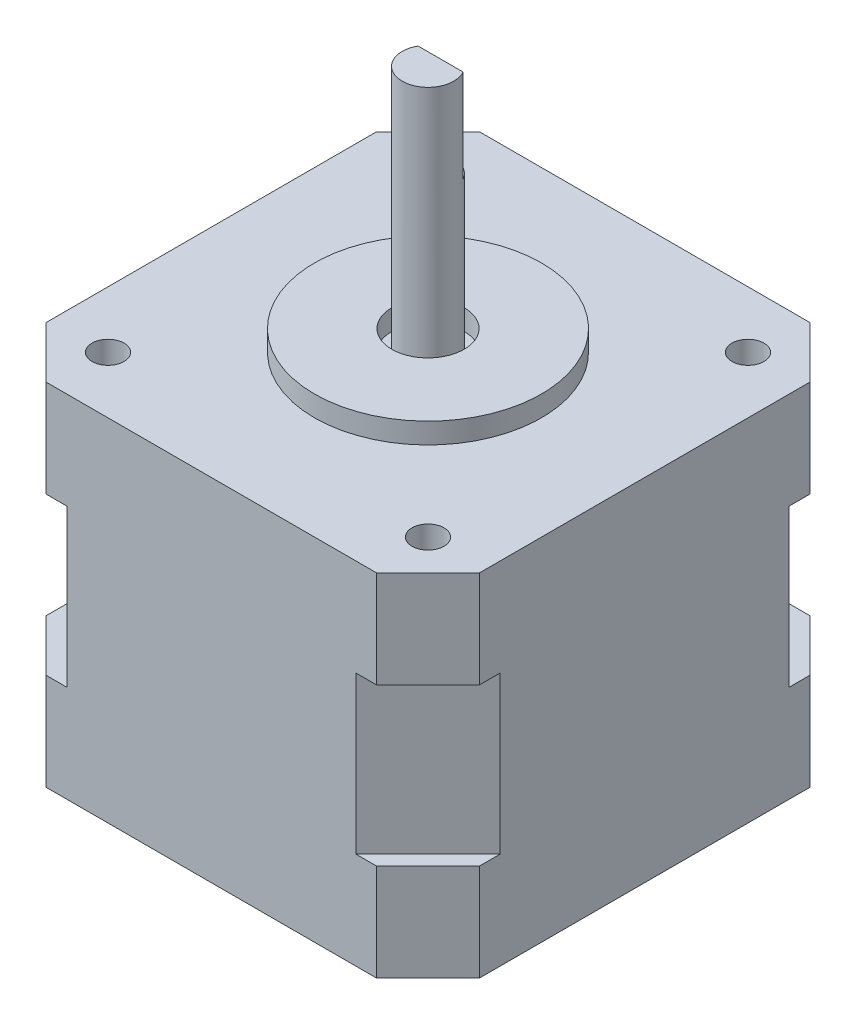
from build123d import *

# Parameters (mm, degrees)
SKETCH4_W               = 42
SKETCH4_H               = 42
BOTTOM_DEPTH            = 9.4
MIDDLE_DEPTH            = 15.2
SKETCH8_W               = 42
SKETCH8_H               = 42
TOP_DEPTH               = 9.4
CHAMFER1_SIZE           = 5
SKETCH9_R               = 11
SKETCH9_R_2             = 3.5
RING_DEPTH              = 2
SKETCH10_R              = 2.5
SHAFT_DEPTH             = 24
CUT_EXTRUDE3_DEPTH      = 5
CUT_EXTRUDE3_DEPTH_BACK = 5
SKETCH11_W              = 2.239647547
SKETCH11_H              = 24.242457261
SKETCH12_R              = 1.55
CUT_EXTRUDE4_DEPTH      = 4.5


with BuildPart() as part:
    # Sketch4 → Bottom (new body)
    with BuildSketch(Plane(origin=(0, 0, 0), x_dir=(1, 0, 0), z_dir=(0, 1, 0))):
        Rectangle(SKETCH4_W, SKETCH4_H)
    extrude(amount=BOTTOM_DEPTH)

    # Sketch6 → Middle (add)
    with BuildSketch(Plane(origin=(0, 9.4, 0), x_dir=(1, 0, 0), z_dir=(0, 1, 0))):
        Polygon((-21, -14), (-14, -21), (14, -21), (21, -14), (21, 14), (14, 21), (-14, 21), (-21, 14), align=None)
    extrude(amount=MIDDLE_DEPTH)

    # Sketch8 → Top (add)
    with BuildSketch(Plane(origin=(0, 24.6, 0), x_dir=(1, 0, 0), z_dir=(0, 1, 0))):
        Rectangle(SKETCH8_W, SKETCH8_H)
    extrude(amount=TOP_DEPTH)

    # Chamfer1
    chamfer1_edges = [part.edges().sort_by_distance(p)[0] for p in [
        (21, 4.7, -21),
        (21, 29.3, -21),
        (-21, 4.7, 21),
        (21, 4.7, 21),
        (21, 29.3, 21),
        (-21, 29.3, 21),
        (-21, 4.7, -21),
        (-21, 29.3, -21),
    ]]
    chamfer(chamfer1_edges, length=CHAMFER1_SIZE)

    # Sketch9 → Ring (add)
    with BuildSketch(Plane(origin=(0, 34, 0), x_dir=(1, 0, 0), z_dir=(0, 1, 0))):
        Circle(SKETCH9_R)
        Circle(SKETCH9_R_2, mode=Mode.SUBTRACT)
    extrude(amount=RING_DEPTH)

    # Sketch10 → Shaft (add)
    with BuildSketch(Plane(origin=(0, 34, 0), x_dir=(1, 0, 0), z_dir=(0, 1, 0))):
        Circle(SKETCH10_R)
    extrude(amount=SHAFT_DEPTH)

    # Sketch11 → Cut-Extrude3 (cut, two sides: drawn at the far end of the back side and taken through both)
    with BuildSketch(Plane(origin=(0, 0, 0), x_dir=(0, 0, -1), z_dir=(1, 0, 0)).offset(-CUT_EXTRUDE3_DEPTH_BACK)):
        with Locations((2.338622492, 61.12122863)):
            Rectangle(SKETCH11_W, SKETCH11_H)
    extrude(amount=CUT_EXTRUDE3_DEPTH + CUT_EXTRUDE3_DEPTH_BACK, mode=Mode.SUBTRACT)

    # Sketch12 → Cut-Extrude4 (cut)
    with BuildSketch(Plane(origin=(0, 34, 0), x_dir=(1, 0, 0), z_dir=(0, 1, 0))):
        with Locations((15.5, -15.5)):
            Circle(SKETCH12_R)
        with Locations((-15.5, -15.5)):
            Circle(SKETCH12_R)
        with Locations((-15.5, 15.5)):
            Circle(SKETCH12_R)
        with Locations((15.5, 15.5)):
            Circle(SKETCH12_R)
    extrude(amount=-CUT_EXTRUDE4_DEPTH, mode=Mode.SUBTRACT)


solid = part.part
